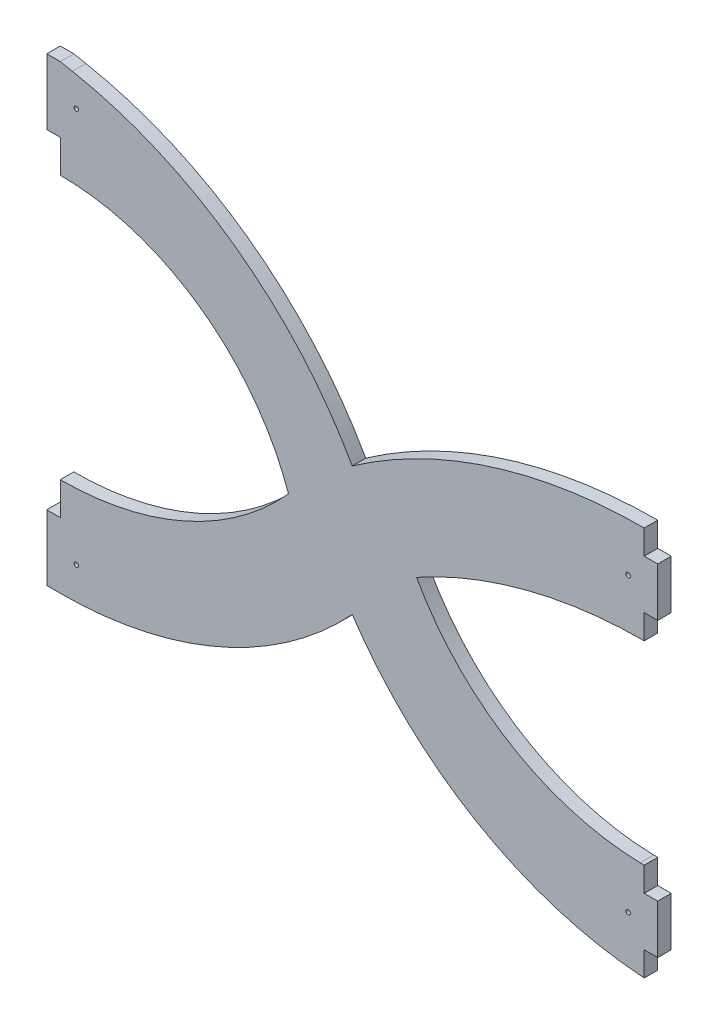
from build123d import *

# Parameters (mm, degrees)
SKETCH1_W           = 241.3
SKETCH1_H           = 198.12
BOSS_EXTRUDE1_DEPTH = 5.334
SKETCH2_W           = 5.334
SKETCH2_H           = 9.652
SKETCH2_H_2         = 96.012
SKETCH2_H_3         = 53.848
CUT_EXTRUDE1_DEPTH  = 179.277190048
SKETCH3_W           = 5.334
SKETCH3_H           = 16.256
SKETCH3_H_2         = 130.048
CUT_EXTRUDE2_DEPTH  = 179.277190048
CUT_EXTRUDE5_DEPTH  = 179.277190048
CUT_EXTRUDE6_DEPTH  = 179.277190048
CUT_EXTRUDE7_DEPTH  = 179.277190048
SKETCH8_R           = 0.889
CUT_EXTRUDE8_DEPTH  = 179.277190048
SKETCH9_R           = 0.889
CUT_EXTRUDE9_DEPTH  = 179.277190048


with BuildPart() as part:
    # Sketch1 → Boss-Extrude1 (new body)
    with BuildSketch(Plane.XY):
        with Locations((-21.329797884, -8.624919689)):
            Rectangle(SKETCH1_W, SKETCH1_H)
    extrude(amount=BOSS_EXTRUDE1_DEPTH)

    # Sketch2 → Cut-Extrude1 (cut, through all)
    with BuildSketch(Plane.XY.offset(5.334)):
        with Locations((96.653202116, -102.858919689)):
            Rectangle(SKETCH2_W, SKETCH2_H)
        with Locations((96.653202116, -30.722919689)):
            Rectangle(SKETCH2_W, SKETCH2_H_2)
        with Locations((96.653202116, 63.511080311)):
            Rectangle(SKETCH2_W, SKETCH2_H_3)
    extrude(amount=-CUT_EXTRUDE1_DEPTH, mode=Mode.SUBTRACT)

    # Sketch3 → Cut-Extrude2 (cut, through all)
    with BuildSketch(Plane.XY.offset(5.334)):
        with Locations((-139.312797884, -99.556919689)):
            Rectangle(SKETCH3_W, SKETCH3_H)
        with Locations((-139.312797884, -0.496919689)):
            Rectangle(SKETCH3_W, SKETCH3_H_2)
    extrude(amount=-CUT_EXTRUDE2_DEPTH, mode=Mode.SUBTRACT)

    # Sketch5 → Cut-Extrude5 (cut, through all)
    with BuildSketch(Plane.XY.offset(5.334)):
        Polygon((-136.645797884, -91.428919689), (93.986202116, -107.684919689), (93.986202116, -162.860416997), (-136.645797884, -146.604416997), align=None)
    extrude(amount=-CUT_EXTRUDE5_DEPTH, mode=Mode.SUBTRACT)

    # Sketch6 → Cut-Extrude6 (cut, through all)
    with BuildSketch(Plane.XY.offset(5.334)):
        Polygon((-136.645797884, 90.435080311), (93.986202116, 46.239080311), (93.986202116, 90.435080311), (-136.645797884, 134.631080311), align=None)
    extrude(amount=-CUT_EXTRUDE6_DEPTH, mode=Mode.SUBTRACT)

    # Sketch7 → Cut-Extrude7 (cut, through all)
    with BuildSketch(Plane.XY.offset(5.334)):
        with BuildLine():
            Line((-131.85688859, 89.517381834), (93.986202116, 46.239080311))
            ThreePointArc((93.986202116, 46.239080311), (33.516562096, 36.909943164), (-21.329797884, 9.790080311))
            ThreePointArc((-21.329797884, 9.790080311), (-67.77177066, 61.883202454), (-131.85688859, 89.517381834))
        make_face()
        with BuildLine():
            Line((-136.645797884, -91.428919689), (93.309245371, -107.637204677))
            ThreePointArc((93.309245371, -107.637204677), (28.257929174, -87.626903784), (-21.329797884, -41.009919689))
            ThreePointArc((-21.329797884, -41.009919689), (-73.717554191, -78.2732768), (-136.645797884, -91.428919689))
        make_face()
        with BuildLine():
            ThreePointArc((93.986202116, 7.631080311), (47.550679246, 1.726898301), (4.070202116, -15.609919689))
            ThreePointArc((4.070202116, -15.609919689), (41.092439587, -54.093369858), (92.347831876, -69.076919689))
            ThreePointArc((92.347831876, -69.076919689), (131.631647498, -31.544467715), (93.986202116, 7.631080311))
        make_face()
        with BuildLine():
            ThreePointArc((-136.645797884, 51.573080311), (-81.408536453, 33.982932584), (-46.514432981, -12.3092902))
            ThreePointArc((-46.514432981, -12.3092902), (-87.289086913, -42.04513502), (-136.645797884, -52.566919689))
            ThreePointArc((-136.645797884, -52.566919689), (-188.715797884, -0.496919689), (-136.645797884, 51.573080311))
        make_face()
    extrude(amount=-CUT_EXTRUDE7_DEPTH, mode=Mode.SUBTRACT)

    # Sketch8 → Cut-Extrude8 (cut, through all)
    with BuildSketch(Plane.XY.offset(5.334)):
        with Locations((-130.295797884, 77.481080311)):
            Circle(SKETCH8_R)
        with Locations((-130.295797884, -78.474919689)):
            Circle(SKETCH8_R)
    extrude(amount=-CUT_EXTRUDE8_DEPTH, mode=Mode.SUBTRACT)

    # Sketch9 → Cut-Extrude9 (cut, through all)
    with BuildSketch(Plane.XY.offset(5.334)):
        with Locations((87.636202116, 26.935080311)):
            Circle(SKETCH9_R)
        with Locations((87.636202116, -88.380919689)):
            Circle(SKETCH9_R)
    extrude(amount=-CUT_EXTRUDE9_DEPTH, mode=Mode.SUBTRACT)


solid = part.part
